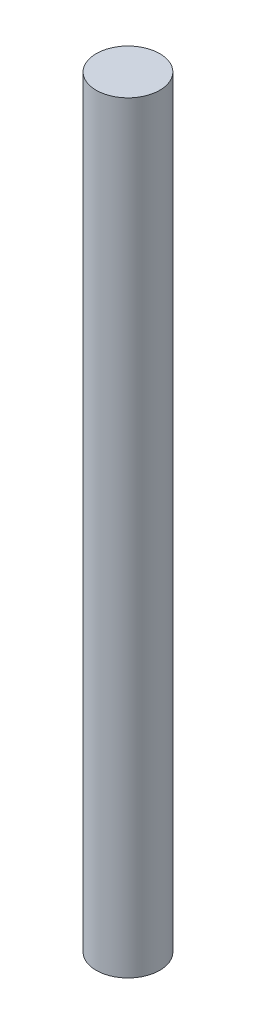
from build123d import *

# Parameters (mm, degrees)
SKETCH1_R           = 2.5
BOSS_EXTRUDE1_DEPTH = 60


with BuildPart() as part:
    # Sketch1 → Boss-Extrude1 (new body)
    with BuildSketch(Plane(origin=(0, 0, 0), x_dir=(1, 0, 0), z_dir=(0, 1, 0))):
        Circle(SKETCH1_R)
    extrude(amount=BOSS_EXTRUDE1_DEPTH)


solid = part.part
